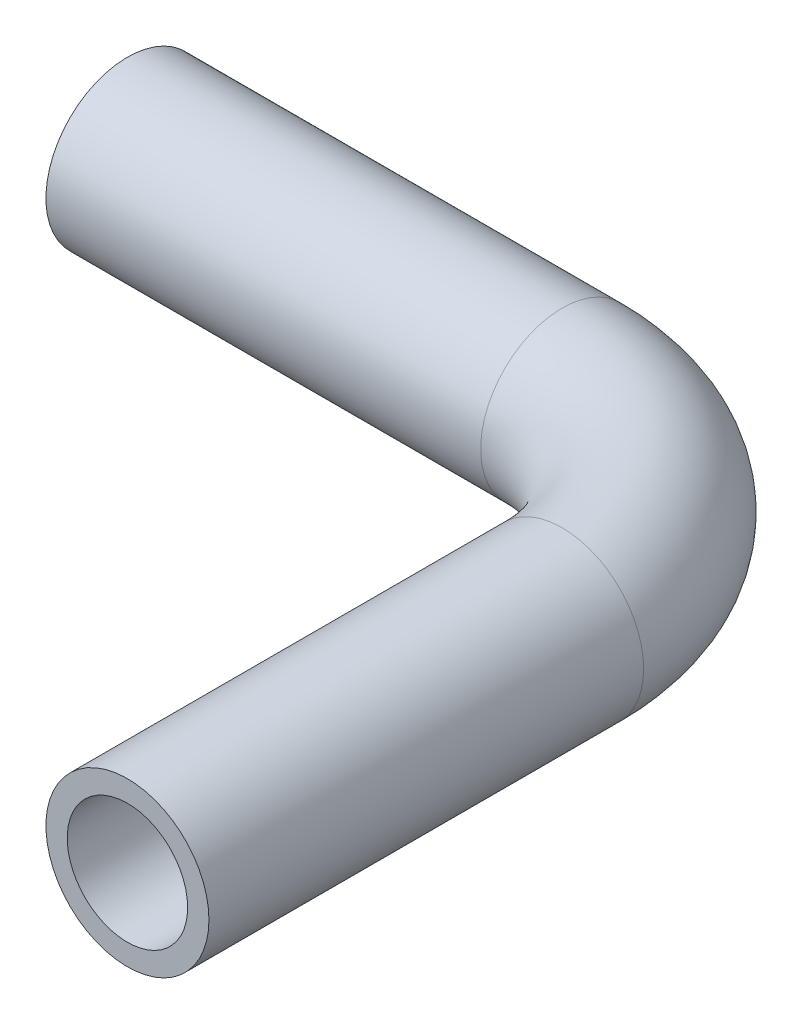
from build123d import *

# Parameters (mm, degrees)
SKETCH4_R                = 4.7625
SKETCH4_R_2              = 3.5179
BOSS_EXTRUDE1_DEPTH      = 12.7
BEND_1_OUTLINE_R         = 4.7625
BEND_1_OUTLINE_R_2       = 3.5179
BEND_1_ANGLE             = 90
SKETCH6_R                = 4.7625
SKETCH6_R_2              = 3.5179
POST_BEND_1_LENGTH_DEPTH = 25.4


# Read off the part's stored shape, not the designer's step: Bend 1
with BuildPart() as part:
    # Sketch4 → Boss-Extrude1 (new, symmetric)
    with BuildSketch(Plane(origin=(0, 0, 0), x_dir=(0, 0, -1), z_dir=(1, 0, 0))):
        Circle(SKETCH4_R)
        Circle(SKETCH4_R_2, mode=Mode.SUBTRACT)
    extrude(amount=BOSS_EXTRUDE1_DEPTH, both=True)

    # Bend 1 outline → Bend 1 (revolve)
    with BuildSketch(Plane(origin=(12.7, 0, 11.1125), x_dir=(1, 0, 0), z_dir=(0, 0, 1))):
        with Locations((11.1125, 0)):
            Circle(BEND_1_OUTLINE_R)
        with Locations((11.1125, 0)):
            Circle(BEND_1_OUTLINE_R_2, mode=Mode.SUBTRACT)
    revolve(axis=Axis((12.7, 0, 11.1125), (0, 1, 0)), revolution_arc=BEND_1_ANGLE)

    # Sketch6 → Post Bend 1 Length (add)
    with BuildSketch(Plane.XY.offset(11.1125)):
        with Locations((23.8125, 0)):
            Circle(SKETCH6_R)
        with Locations((23.8125, 0)):
            Circle(SKETCH6_R_2, mode=Mode.SUBTRACT)
    extrude(amount=POST_BEND_1_LENGTH_DEPTH)


solid = part.part
